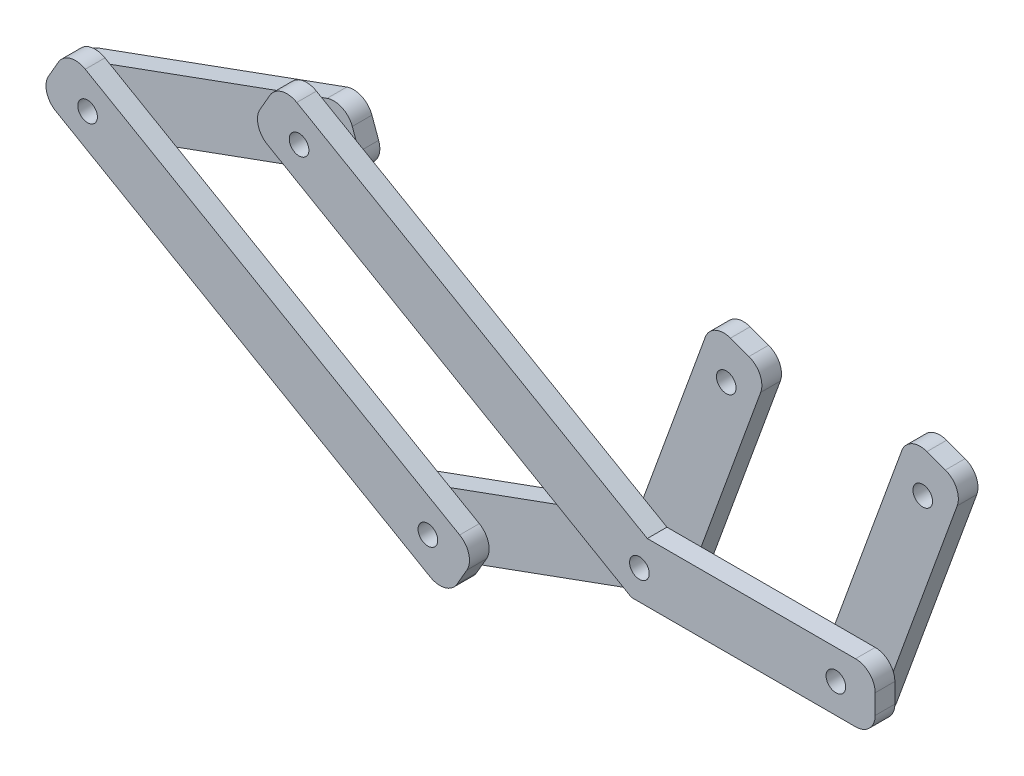
from build123d import *

# Parameters (mm, degrees)
SKETCH2_R           = 5
BOSS_EXTRUDE1_DEPTH = 10
SKETCH5_R           = 5
BOSS_EXTRUDE2_DEPTH = 10
SKETCH7_R           = 5
BOSS_EXTRUDE3_DEPTH = 10
SKETCH8_R           = 5
BOSS_EXTRUDE4_DEPTH = 10
SKETCH11_R          = 5
BOSS_EXTRUDE5_DEPTH = 10


with BuildPart() as part:
    # Sketch2 → Boss-Extrude1 (new body)
    with BuildSketch(Plane.XY.offset(180)):
        with BuildLine():
            Line((2.141939763, 20.503953132), (11.53886597, 17.083751699))
            ThreePointArc((11.53886597, 17.083751699), (17.181742408, 11.913008109), (17.515590745, 4.266624058))
            Line((17.515590745, 4.266624058), (-22.498924202, -105.672352209))
            Line((-22.498924202, -105.672352209), (-146.102774293, -150.660474483))
            ThreePointArc((-146.102774293, -150.660474483), (-153.749158344, -150.326626146), (-158.919901934, -144.683749709))
            Line((-158.919901934, -144.683749709), (-162.340103367, -135.286823501))
            ThreePointArc((-162.340103367, -135.286823501), (-162.00625503, -127.64043945), (-156.363378593, -122.46969586))
            Line((-156.363378593, -122.46969586), (-45.905104463, -82.266171948))
            Line((-45.905104463, -82.266171948), (-10.675187879, 14.527228358))
            ThreePointArc((-10.675187879, 14.527228358), (-5.504444288, 20.170104795), (2.141939763, 20.503953132))
        make_face()
        Circle(SKETCH2_R, mode=Mode.SUBTRACT)
        with Locations((-34.202014333, -93.969262079)):
            Circle(SKETCH2_R, mode=Mode.SUBTRACT)
        with Locations((-141.836150235, -133.144883738)):
            Circle(SKETCH2_R, mode=Mode.SUBTRACT)
    extrude(amount=BOSS_EXTRUDE1_DEPTH)


with BuildPart() as part_1:
    # Body-Move/Copy1: moved
    add(part.part.moved(Location((270, 0, 0))))


with BuildPart() as body_2:
    # Sketch5 → Boss-Extrude2 (new body)
    with BuildSketch(Plane.XY.offset(190)):
        with BuildLine():
            Line((102.141939763, 20.503953132), (111.53886597, 17.083751699))
            ThreePointArc((111.53886597, 17.083751699), (117.181742408, 11.913008109), (117.515590745, 4.266624058))
            Line((117.515590745, 4.266624058), (76.473173546, -108.496490436))
            ThreePointArc((76.473173546, -108.496490436), (71.302429956, -114.139366873), (63.656045905, -114.473215211))
            Line((63.656045905, -114.473215211), (54.259119697, -111.053013778))
            ThreePointArc((54.259119697, -111.053013778), (48.61624326, -105.882270187), (48.282394922, -98.235886137))
            Line((48.282394922, -98.235886137), (89.324812121, 14.527228358))
            ThreePointArc((89.324812121, 14.527228358), (94.495555712, 20.170104795), (102.141939763, 20.503953132))
        make_face()
        with Locations((100, 0)):
            Circle(SKETCH5_R, mode=Mode.SUBTRACT)
        with Locations((65.797985667, -93.969262079)):
            Circle(SKETCH5_R, mode=Mode.SUBTRACT)
    extrude(amount=BOSS_EXTRUDE2_DEPTH)


with BuildPart() as body_2_1:
    # Body-Move/Copy2: moved
    add(body_2.part.moved(Location((270, 0, -10))))


with BuildPart() as body_3:
    # Sketch7 → Boss-Extrude3 (new body)
    with BuildSketch(Plane.XY.offset(190)):
        with BuildLine():
            Line((85.797985667, -88.969262079), (85.797985667, -98.969262079))
            ThreePointArc((85.797985667, -98.969262079), (82.869053479, -106.04032989), (75.797985667, -108.969262079))
            Line((75.797985667, -108.969262079), (-38.221252219, -108.969262079))
            Line((-38.221252219, -108.969262079), (-223.567349127, -1.959643135))
            ThreePointArc((-223.567349127, -1.959643135), (-228.22660739, 4.112420451), (-227.227603165, 11.700610902))
            Line((-227.227603165, 11.700610902), (-222.227603165, 20.36086494))
            ThreePointArc((-222.227603165, 20.36086494), (-216.155539578, 25.020123203), (-208.567349127, 24.021118978))
            Line((-208.567349127, 24.021118978), (-30.182776446, -78.969262079))
            Line((-30.182776446, -78.969262079), (75.797985667, -78.969262079))
            ThreePointArc((75.797985667, -78.969262079), (82.869053479, -81.898194267), (85.797985667, -88.969262079))
        make_face()
        with Locations((65.797985667, -93.969262079)):
            Circle(SKETCH7_R, mode=Mode.SUBTRACT)
        with Locations((-34.202014333, -93.969262079)):
            Circle(SKETCH7_R, mode=Mode.SUBTRACT)
        with Locations((-207.407095089, 6.030737921)):
            Circle(SKETCH7_R, mode=Mode.SUBTRACT)
    extrude(amount=BOSS_EXTRUDE3_DEPTH)


with BuildPart() as body_3_1:
    # Body-Move/Copy3: moved
    add(body_3.part.moved(Location((270, 0, 0))))


with BuildPart() as body_4:
    # Sketch8 → Boss-Extrude4 (new body)
    with BuildSketch(Plane.XY.offset(190)):
        with BuildLine():
            Line((-329.861739068, -18.814756719), (-334.861739068, -27.475010757))
            ThreePointArc((-334.861739068, -27.475010757), (-335.860743293, -35.063201208), (-331.20148503, -41.135264795))
            Line((-331.20148503, -41.135264795), (-140.675896197, -151.135264795))
            ThreePointArc((-140.675896197, -151.135264795), (-133.087705746, -152.13426902), (-127.015642159, -147.475010757))
            Line((-127.015642159, -147.475010757), (-122.015642159, -138.814756719))
            ThreePointArc((-122.015642159, -138.814756719), (-121.016637934, -131.226566268), (-125.675896197, -125.154502681))
            Line((-125.675896197, -125.154502681), (-316.20148503, -15.154502681))
            ThreePointArc((-316.20148503, -15.154502681), (-323.789675481, -14.155498456), (-329.861739068, -18.814756719))
        make_face()
        with Locations((-141.836150235, -133.144883738)):
            Circle(SKETCH8_R, mode=Mode.SUBTRACT)
        with Locations((-315.041230992, -33.144883738)):
            Circle(SKETCH8_R, mode=Mode.SUBTRACT)
    extrude(amount=BOSS_EXTRUDE4_DEPTH)


with BuildPart() as body_4_1:
    # Body-Move/Copy5: moved
    add(body_4.part.moved(Location((270, 0, 0))))


with BuildPart() as body_5:
    # Sketch11 → Boss-Extrude5 (new body)
    with BuildSketch(Plane.XY.offset(180)):
        with BuildLine():
            Line((-335.545184124, -35.286823501), (-332.124982691, -44.683749709))
            ThreePointArc((-332.124982691, -44.683749709), (-326.954239101, -50.326626146), (-319.30785505, -50.660474483))
            Line((-319.30785505, -50.660474483), (-192.879866732, -4.644449957))
            ThreePointArc((-192.879866732, -4.644449957), (-187.236990295, 0.526293633), (-186.903141957, 8.172677684))
            Line((-186.903141957, 8.172677684), (-190.32334339, 17.569603892))
            ThreePointArc((-190.32334339, 17.569603892), (-195.494086981, 23.212480329), (-203.140471031, 23.546328666))
            Line((-203.140471031, 23.546328666), (-329.56845935, -22.46969586))
            ThreePointArc((-329.56845935, -22.46969586), (-335.211335787, -27.64043945), (-335.545184124, -35.286823501))
        make_face()
        with Locations((-315.041230992, -33.144883738)):
            Circle(SKETCH11_R, mode=Mode.SUBTRACT)
        with Locations((-207.407095089, 6.030737921)):
            Circle(SKETCH11_R, mode=Mode.SUBTRACT)
    extrude(amount=BOSS_EXTRUDE5_DEPTH)


with BuildPart() as body_5_1:
    # Body-Move/Copy6: moved
    add(body_5.part.moved(Location((270, 0, 0))))


solid = Compound([part_1.part, body_2_1.part, body_3_1.part, body_4_1.part, body_5_1.part])
